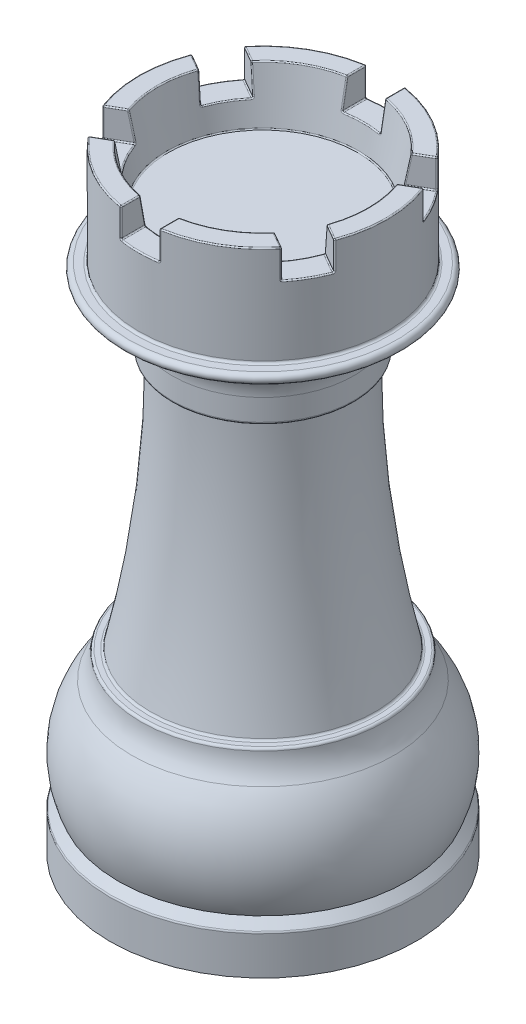
from build123d import *

# Parameters (mm, degrees)
CUT_EXTRUDE3_DEPTH = 3
FILLET1_R          = 0.125
SCALE1_SCALE       = 0.71875
SKETCH3_R          = 10.2
CUT_EXTRUDE4_DEPTH = 7
SKETCH6_W          = 10.75
SKETCH6_H          = 1


with BuildPart() as part:
    # Sketch1 → Revolve1 (revolve)
    with BuildSketch(Plane.XY):
        with BuildLine():
            Line((16, 4), (16, 0))
            Line((16, 0), (0, 0))
            Line((0, 0), (0, 58.5))
            Line((0, 58.5), (10.030205099, 58.5))
            Line((10.030205099, 58.5), (11, 63.99998019))
            Line((11, 63.99998019), (13, 63.99998019))
            Line((13, 63.99998019), (13, 53.78125))
            ThreePointArc((13, 53.78125), (13.073223305, 53.604473305), (13.25, 53.53125))
            Line((13.25, 53.53125), (14.03125, 53.53125))
            ThreePointArc((14.03125, 53.53125), (14.53125, 53.03125), (14.03125, 52.53125))
            ThreePointArc((14.03125, 52.53125), (10.827172398, 51.204077602), (9.5, 48))
            Line((9.5, 48), (9.5, 45.75))
            ThreePointArc((9.5, 45.75), (9.426776695, 45.573223305), (9.25, 45.5))
            Line((9.25, 45.5), (9, 45.5))
            ThreePointArc((9, 45.5), (8.823531814, 45.427084667), (8.75000152, 45.250871834))
            ThreePointArc((8.75000152, 45.250871834), (9.480787471, 31.884631978), (11.756493413, 18.693287147))
            ThreePointArc((11.756493413, 18.693287147), (11.844552759, 18.554195339), (12, 18.5))
            Line((12, 18.5), (12.5, 18.5))
            ThreePointArc((12.5, 18.5), (12.672025963, 18.431403054), (12.749648281, 18.263256543))
            ThreePointArc((12.749648281, 18.263256543), (13.034996076, 16.915224998), (13.719280159, 15.719245189))
            ThreePointArc((13.719280159, 15.719245189), (15.914405684, 10.553717167), (15.103553391, 5))
            Line((15.103553391, 5), (15.926776695, 4.176776695))
            ThreePointArc((15.926776695, 4.176776695), (15.980969883, 4.095670858), (16, 4))
        make_face()
    revolve(axis=Axis((0, 0, 0), (0, -1, 0)))

    # Sketch2 → Cut-Extrude3 (cut)
    with BuildSketch(Plane(origin=(0, 63.99998019, 0), x_dir=(1, 0, 0), z_dir=(0, 1, 0))):
        Polygon((13.46466686, 5.464427959), (11.46466686, 8.928529574), (2, 3.464101615), (2, 14.392957534), (-2, 14.392957534), (-2, 3.464101615), (-11.46466686, 8.928529574), (-13.46466686, 5.464427959), (-4, 0), (-13.46466686, -5.464427959), (-11.46466686, -8.928529574), (-2, -3.464101615), (-2, -14.392957534), (2, -14.392957534), (2, -3.464101615), (11.46466686, -8.928529574), (13.46466686, -5.464427959), (4, 0), align=None)
    extrude(amount=-CUT_EXTRUDE3_DEPTH, mode=Mode.SUBTRACT)

    # Fillet1
    fillet1_edges = [part.edges().sort_by_distance(p)[0] for p in [
        (12.124297731, 62.49998019, -4.690565482),
        (10.124297731, 62.49998019, -8.154667097),
        (2, 62.49998019, -12.845232579),
        (-2, 62.49998019, -12.845232579),
        (-10.124297731, 62.49998019, -8.154667097),
        (-12.124297731, 62.49998019, -4.690565482),
        (-12.124297731, 62.49998019, 4.690565482),
        (-10.124297731, 62.49998019, 8.154667097),
        (-2, 62.49998019, 12.845232579),
        (2, 62.49998019, 12.845232579),
        (10.124297731, 62.49998019, 8.154667097),
        (12.124297731, 62.49998019, 4.690565482),
        (6.5, 63.99998019, -11.258330249),
        (9.245897364, 63.99998019, -7.647522409),
        (2, 63.99998019, -11.830943203),
        (-9.245897364, 63.99998019, -7.647522409),
        (-6.5, 63.99998019, -11.258330249),
        (-2, 63.99998019, -11.830943203),
        (-11.245897364, 63.99998019, -4.183420794),
        (-11.245897364, 63.99998019, 4.183420794),
        (-13, 63.99998019, 0),
        (-9.245897364, 63.99998019, 7.647522409),
        (-2, 63.99998019, 11.830943203),
        (-6.5, 63.99998019, 11.258330249),
        (9.245897364, 63.99998019, 7.647522409),
        (6.5, 63.99998019, 11.258330249),
        (2, 63.99998019, 11.830943203),
        (12.77919932, 63.99998019, -2.385804843),
        (11.245897364, 63.99998019, 4.183420794),
        (11.245897364, 63.99998019, -4.183420794),
        (11.012757815, 60.99998019, -4.048817612),
        (9.012757815, 60.99998019, -7.512919227),
        (11.258330249, 60.99998019, -6.5),
        (2, 60.99998019, -11.561736839),
        (-2, 60.99998019, -11.561736839),
        (0, 60.99998019, -13),
        (-9.012757815, 60.99998019, -7.512919227),
        (-11.012757815, 60.99998019, -4.048817612),
        (-11.258330249, 60.99998019, -6.5),
        (-11.012757815, 60.99998019, 4.048817612),
        (-9.012757815, 60.99998019, 7.512919227),
        (-11.258330249, 60.99998019, 6.5),
        (-2, 60.99998019, 11.561736839),
        (2, 60.99998019, 11.561736839),
        (0, 60.99998019, 13),
        (9.012757815, 60.99998019, 7.512919227),
        (11.012757815, 60.99998019, 4.048817612),
        (11.258330249, 60.99998019, 6.5),
        (-9.068168508, 60.99998019, 5.235509529),
        (-10.13445755, 62.499959445, 3.541730718),
        (-11, 63.99998019, 0),
        (-10.13445755, 62.499959445, -3.541730718),
        (-9.068168508, 60.99998019, -5.235509529),
        (-8.13445755, 62.499959445, -7.005832333),
        (-5.5, 63.99998019, -9.526279442),
        (-2, 62.499959445, -10.547563051),
        (0, 60.99998019, -10.471019058),
        (2, 62.499959445, -10.547563051),
        (5.5, 63.99998019, -9.526279442),
        (8.13445755, 62.499959445, -7.005832333),
        (9.068168508, 60.99998019, -5.235509529),
        (10.13445755, 62.499959445, -3.541730718),
        (10.840721078, 63.99998019, -1.865145172),
        (10.13445755, 62.499959445, 3.541730718),
        (9.068168508, 60.99998019, 5.235509529),
        (8.13445755, 62.499959445, 7.005832333),
        (5.5, 63.99998019, 9.526279442),
        (2, 62.499959445, 10.547563051),
        (0, 60.99998019, 10.471019058),
        (-2, 62.499959445, 10.547563051),
        (-5.5, 63.99998019, 9.526279442),
        (-8.13445755, 62.499959445, 7.005832333),
        (-10.030205099, 58.5, 0),
    ]]
    fillet(fillet1_edges, radius=FILLET1_R)


with BuildPart() as part_1:
    # Scale1: scaled about (0, 0, 0)
    add(part.part.scale(SCALE1_SCALE))

    # Sketch3 → Cut-Extrude4 (cut)
    with BuildSketch(Plane.XZ):
        Circle(SKETCH3_R)
    extrude(amount=-CUT_EXTRUDE4_DEPTH, mode=Mode.SUBTRACT)

    # Sketch6 → Cut-Revolve1 (revolve, cut)
    with BuildSketch(Plane.XY):
        with Locations((-5.375, 0.5)):
            Rectangle(SKETCH6_W, SKETCH6_H)
    revolve(axis=Axis((0, 0, 0), (0, -1, 0)), mode=Mode.SUBTRACT)


with BuildPart() as body_2:
    # Sketch8 → Base (White Rook) (revolve)
    with BuildSketch(Plane.XY):
        Polygon((-10, 2.5), (-10, 1), (-10.55, 1), (-10.55, 0), (0, 0), (0, 2.5), align=None)
    revolve(axis=Axis((0, 0, 0), (0, -1, 0)))


solid = Compound([part_1.part, body_2.part])
